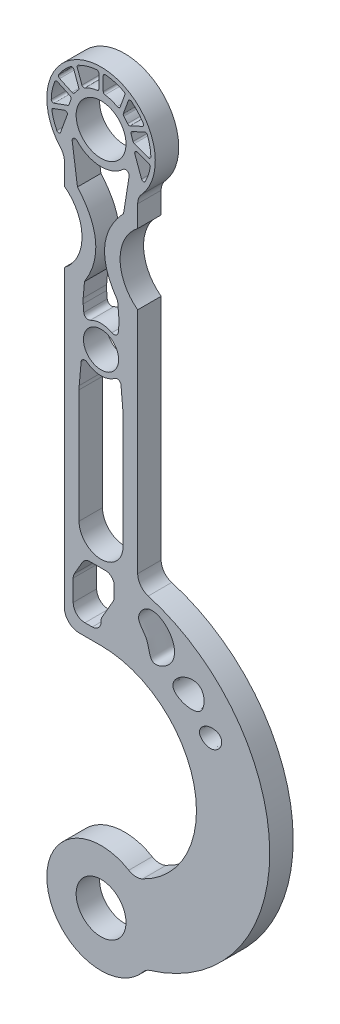
from build123d import *

# Parameters (mm, degrees)
BOSS_EXTRUDE1_OUTLINE_R   = 8.5
BOSS_EXTRUDE1_OUTLINE_R_2 = 6
BOSS_EXTRUDE1_DEPTH       = 8
FILLET1_R                 = 5


# Read off the part's stored shape, not the designer's step: Boss-Extrude1
with BuildPart() as part:
    # Boss-Extrude1 outline → Boss-Extrude1 (new body)
    with BuildSketch(Plane.XY):
        with BuildLine():
            ThreePointArc((11.444366088, -215.464647068), (-18.29086587, -232.773846738), (15.239317045, -240.488718511))
            ThreePointArc((15.239317045, -240.488718511), (57.52601951, -183.58870793), (12.5, -128.830749818))
            Line((12.5, -128.830749818), (12.5, -47))
            ThreePointArc((12.5, -47), (6.5, -35), (12.5, -23))
            Line((12.5, -23), (12.5, -13.638181697))
            ThreePointArc((12.5, -13.638181697), (0, 18.5), (-12.5, -13.638181697))
            Line((-12.5, -13.638181697), (-12.5, -23))
            ThreePointArc((-12.5, -23), (-6.5, -35), (-12.5, -47))
            Line((-12.5, -47), (-12.5, -152.456671403))
            Line((-12.5, -152.456671403), (0, -152.456671403))
            ThreePointArc((0, -152.456671403), (32.019441409, -179.184193262), (11.444366088, -215.464647068))
        make_face()
        with Locations((0, -230)):
            Circle(BOSS_EXTRUDE1_OUTLINE_R, mode=Mode.SUBTRACT)
        with BuildLine():
            Line((0, -145.26051898), (0, -145.456671403))
            ThreePointArc((0, -145.456671403), (-0.878679656, -147.577991747), (-3, -148.456671403))
            Line((-3, -148.456671403), (-5.5, -148.456671403))
            ThreePointArc((-5.5, -148.456671403), (-8.328427125, -147.285098528), (-9.5, -144.456671403))
            Line((-9.5, -144.456671403), (-9.5, -137.26051898))
            ThreePointArc((-9.5, -137.26051898), (-9.397777479, -136.484061845), (-9.098076211, -135.76051898))
            Line((-9.098076211, -135.76051898), (-6.366025404, -131.028468173))
            ThreePointArc((-6.366025404, -131.028468173), (-5.267949192, -129.930391962), (-3.767949192, -129.528468173))
            Line((-3.767949192, -129.528468173), (1.5, -129.528468173))
            ThreePointArc((1.5, -129.528468173), (3.621320344, -130.407147829), (4.5, -132.528468173))
            Line((4.5, -132.528468173), (4.5, -135.858595192))
            ThreePointArc((4.5, -135.858595192), (4.397777479, -136.635052327), (4.098076211, -137.358595192))
            Line((4.098076211, -137.358595192), (0.401923789, -143.76051898))
            ThreePointArc((0.401923789, -143.76051898), (0.102222521, -144.484061845), (0, -145.26051898))
        make_face(mode=Mode.SUBTRACT)
        with BuildLine():
            add(Edge.make_bspline(
                [(12.815143019, -137.878749683), (12.866993456, -139.570347571), (16.491087034, -142.280223185), (16.310410409, -150.377955966), (25.734531415, -146.267961615), (25.451879628, -136.604366129), (16.250652394, -131.320333816), (12.769637961, -136.394167023), (12.815143019, -137.878749683)],
                knots=[0, 0, 0, 0, 0.137048811, 0.2897108, 0.433708709, 0.660987574, 0.879723018, 1, 1, 1, 1], degree=3))
        make_face(mode=Mode.SUBTRACT)
        with BuildLine():
            add(Edge.make_bspline(
                [(24.511120075, -152.176773926), (24.850121969, -154.996634181), (32.927811052, -157.589174397), (35.554505954, -152.068234857), (34.488723033, -145.982053155), (26.960336222, -147.163037807), (24.367171844, -150.979394496), (24.511120075, -152.176773926)],
                knots=[0, 0, 0, 0, 0.33322372, 0.433356634, 0.598927888, 0.858505319, 1, 1, 1, 1], degree=3))
        make_face(mode=Mode.SUBTRACT)
        with BuildLine():
            add(Edge.make_bspline(
                [(33.562174624, -161.381398687), (33.690796307, -162.673135115), (36.87002002, -165.289122939), (41.07485268, -162.86784016), (41.421142388, -158.168250022), (36.061210717, -157.141905351), (33.435237138, -160.106576511), (33.562174624, -161.381398687)],
                knots=[0, 0, 0, 0, 0.203415558, 0.436316979, 0.557525748, 0.799248005, 1, 1, 1, 1], degree=3))
        make_face(mode=Mode.SUBTRACT)
        with BuildLine():
            Line((-7.442920471, -79.347578002), (-6.805813949, -72.065417124))
            ThreePointArc((-6.805813949, -72.065417124), (-6.034209722, -70.988761075), (-4.719159836, -71.147522301))
            ThreePointArc((-4.719159836, -71.147522301), (0, -72.75), (4.719159836, -71.147522301))
            ThreePointArc((4.719159836, -71.147522301), (6.034209722, -70.988761075), (6.805813949, -72.065417124))
            Line((6.805813949, -72.065417124), (7.442920471, -79.347578002))
            ThreePointArc((7.442920471, -79.347578002), (7.485723324, -80.000623333), (7.5, -80.654914144))
            Line((7.5, -80.654914144), (7.5, -119.456671403))
            ThreePointArc((7.5, -119.456671403), (0, -126.956671403), (-7.5, -119.456671403))
            Line((-7.5, -119.456671403), (-7.5, -80.654914144))
            ThreePointArc((-7.5, -80.654914144), (-7.485723324, -80.000623333), (-7.442920471, -79.347578002))
        make_face(mode=Mode.SUBTRACT)
        with Locations((0, -65)):
            Circle(BOSS_EXTRUDE1_OUTLINE_R_2, mode=Mode.SUBTRACT)
        with BuildLine():
            add(Edge.make_bspline(
                [(5.648127088, -47.738954624), (-4.174062702, -33.842492349), (7.673926753, -21)],
                knots=[0, 0, 0, 1, 1, 1], degree=2))
            Line((5.648127088, -47.738954624), (6.09481015, -52.844565385))
            ThreePointArc((6.09481015, -52.844565385), (6.132863169, -53.716122812), (6.09481015, -54.58768024))
            Line((6.09481015, -54.58768024), (5.884715734, -56.989070402))
            ThreePointArc((5.884715734, -56.989070402), (5.102294219, -58.178655062), (3.678463089, -58.178606498))
            ThreePointArc((3.678463089, -58.178606498), (0, -57.25), (-3.678463089, -58.178606498))
            ThreePointArc((-3.678463089, -58.178606498), (-5.102294219, -58.178655062), (-5.884715734, -56.989070402))
            Line((-5.884715734, -56.989070402), (-6.09481015, -54.58768024))
            ThreePointArc((-6.09481015, -54.58768024), (-6.132863169, -53.716122813), (-6.09481015, -52.844565385))
            Line((-6.09481015, -52.844565385), (-5.648127088, -47.738954624))
            add(Edge.make_bspline(
                [(-5.648127088, -47.738954624), (3.128574043, -33.737896343), (-8.048642471, -21)],
                knots=[0, 0, 0, 1, 1, 1], degree=2))
            Line((-8.048642471, -21), (-9.841693034, -8.241782316))
            ThreePointArc((-9.841693034, -8.241782316), (-9.277765095, -7.198046285), (-8.113806218, -7.42739178))
            ThreePointArc((-8.113806218, -7.42739178), (-0.397271684, -10.992823805), (7.556500402, -7.993703877))
            ThreePointArc((7.556500402, -7.993703877), (8.94060696, -7.804298326), (9.566071909, -9.053465659))
            Line((9.566071909, -9.053465659), (7.673926753, -21))
        make_face(mode=Mode.SUBTRACT)
        with BuildLine():
            ThreePointArc((-13.815819109, -7.73639942), (-14.428534406, -8.19553291), (-15.095169757, -7.818941744))
            ThreePointArc((-15.095169757, -7.818941744), (-16.142337475, -5.331504557), (-16.782656624, -2.709693088))
            ThreePointArc((-16.782656624, -2.709693088), (-16.695278148, -2.243744795), (-16.331020158, -1.940332656))
            Line((-16.331020158, -1.940332656), (-12.41062413, -0.513425195))
            ThreePointArc((-12.41062413, -0.513425195), (-11.676235283, -0.676235283), (-11.513425195, -1.41062413))
            Line((-11.513425195, -1.41062413), (-13.815819109, -7.73639942))
        make_face(mode=Mode.SUBTRACT)
        with BuildLine():
            ThreePointArc((-16.055325896, -0.243721492), (-16.703494721, -0.154196787), (-16.994514107, 0.431845204))
            ThreePointArc((-16.994514107, 0.431845204), (-16.65249891, 3.419690051), (-15.789347435, 6.300516452))
            ThreePointArc((-15.789347435, 6.300516452), (-15.397147551, 6.691822959), (-14.843365052, 6.675498873))
            Line((-14.843365052, 6.675498873), (-10.625129371, 4.708503271))
            ThreePointArc((-10.625129371, 4.708503271), (-10.278465342, 4.351932823), (-10.256089691, 3.855125251))
            Line((-10.256089691, 3.855125251), (-10.893744246, 1.918908676))
            ThreePointArc((-10.893744246, 1.918908676), (-11.056048513, 1.650608269), (-11.31920261, 1.48008641))
            Line((-11.31920261, 1.48008641), (-16.055325896, -0.243721492))
        make_face(mode=Mode.SUBTRACT)
        with BuildLine():
            ThreePointArc((-14.124081329, 7.995158243), (-14.499364019, 8.430566103), (-14.422099711, 9.000168884))
            ThreePointArc((-14.422099711, 9.000168884), (-12.600334129, 11.41190518), (-10.380271471, 13.462910688))
            ThreePointArc((-10.380271471, 13.462910688), (-9.757749538, 13.580817681), (-9.295063694, 13.147969642))
            Line((-9.295063694, 13.147969642), (-7.609901039, 8.518023301))
            ThreePointArc((-7.609901039, 8.518023301), (-7.584328716, 8.126875897), (-7.773038001, 7.783307795))
            ThreePointArc((-7.773038001, 7.783307795), (-8.440915114, 7.053435477), (-9.040513356, 6.266507661))
            ThreePointArc((-9.040513356, 6.266507661), (-9.433041522, 5.989569146), (-9.911651534, 6.03086997))
            Line((-9.911651534, 6.03086997), (-14.124081329, 7.995158243))
        make_face(mode=Mode.SUBTRACT)
        Circle(BOSS_EXTRUDE1_OUTLINE_R, mode=Mode.SUBTRACT)
        with BuildLine():
            ThreePointArc((-1.363247863, 10.915198361), (-3.503879738, 10.42702387), (-5.504917648, 9.523438543))
            ThreePointArc((-5.504917648, 9.523438543), (-6.094474876, 9.471628924), (-6.513015424, 9.890061441))
            Line((-6.513015424, 9.890061441), (-8.103729904, 14.260513555))
            ThreePointArc((-8.103729904, 14.260513555), (-8.097642283, 14.755448186), (-7.765709582, 15.122623935))
            ThreePointArc((-7.765709582, 15.122623935), (-4.726439667, 16.329751011), (-1.512269939, 16.932602861))
            ThreePointArc((-1.512269939, 16.932602861), (-0.977553684, 16.751899555), (-0.75, 16.235378037))
            Line((-0.75, 16.235378037), (-0.75, 11.609801893))
            ThreePointArc((-0.75, 11.609801893), (-0.925249347, 11.146512834), (-1.363247863, 10.915198361))
        make_face(mode=Mode.SUBTRACT)
        with BuildLine():
            ThreePointArc((1.512269939, 16.932602861), (4.726439667, 16.329751011), (7.765709582, 15.122623935))
            ThreePointArc((7.765709582, 15.122623935), (8.097642283, 14.755448186), (8.103729904, 14.260513555))
            Line((8.103729904, 14.260513555), (6.513015424, 9.890061441))
            ThreePointArc((6.513015424, 9.890061441), (6.094474876, 9.471628924), (5.504917648, 9.523438543))
            ThreePointArc((5.504917648, 9.523438543), (3.503879738, 10.42702387), (1.363247863, 10.915198361))
            ThreePointArc((1.363247863, 10.915198361), (0.925249347, 11.146512834), (0.75, 11.609801893))
            Line((0.75, 11.609801893), (0.75, 16.235378037))
            ThreePointArc((0.75, 16.235378037), (0.977553684, 16.751899555), (1.512269939, 16.932602861))
        make_face(mode=Mode.SUBTRACT)
        with BuildLine():
            Line((13.815819109, -7.73639942), (11.513425195, -1.41062413))
            ThreePointArc((11.513425195, -1.41062413), (11.676235283, -0.676235283), (12.41062413, -0.513425195))
            Line((12.41062413, -0.513425195), (16.331020158, -1.940332656))
            ThreePointArc((16.331020158, -1.940332656), (16.695278148, -2.243744795), (16.782656624, -2.709693088))
            ThreePointArc((16.782656624, -2.709693088), (16.142337475, -5.331504557), (15.095169757, -7.818941744))
            ThreePointArc((15.095169757, -7.818941744), (14.428534406, -8.19553291), (13.815819109, -7.73639942))
        make_face(mode=Mode.SUBTRACT)
        with BuildLine():
            Line((7.609901039, 8.518023301), (9.295063694, 13.147969642))
            ThreePointArc((9.295063694, 13.147969642), (9.757749538, 13.580817681), (10.380271471, 13.462910688))
            ThreePointArc((10.380271471, 13.462910688), (12.600334129, 11.41190518), (14.422099711, 9.000168884))
            ThreePointArc((14.422099711, 9.000168884), (14.499364019, 8.430566103), (14.124081329, 7.995158243))
            Line((14.124081329, 7.995158243), (9.911651534, 6.03086997))
            ThreePointArc((9.911651534, 6.03086997), (9.433041522, 5.989569146), (9.040513356, 6.266507661))
            ThreePointArc((9.040513356, 6.266507661), (8.440915114, 7.053435477), (7.773038001, 7.783307795))
            ThreePointArc((7.773038001, 7.783307795), (7.584328716, 8.126875897), (7.609901039, 8.518023301))
        make_face(mode=Mode.SUBTRACT)
        with BuildLine():
            ThreePointArc((11.31920261, 1.48008641), (11.056048513, 1.650608269), (10.893744246, 1.918908676))
            Line((10.893744246, 1.918908676), (10.256089691, 3.855125251))
            ThreePointArc((10.256089691, 3.855125251), (10.278465342, 4.351932823), (10.625129371, 4.708503271))
            Line((10.625129371, 4.708503271), (14.843365052, 6.675498873))
            ThreePointArc((14.843365052, 6.675498873), (15.397147551, 6.691822959), (15.789347435, 6.300516452))
            ThreePointArc((15.789347435, 6.300516452), (16.65249891, 3.419690051), (16.994514107, 0.431845204))
            ThreePointArc((16.994514107, 0.431845204), (16.703494721, -0.154196787), (16.055325896, -0.243721492))
            Line((16.055325896, -0.243721492), (11.31920261, 1.48008641))
        make_face(mode=Mode.SUBTRACT)
    extrude(amount=BOSS_EXTRUDE1_DEPTH)

    # Fillet1
    fillet1_edges = [part.edges().sort_by_distance(p)[0] for p in [
        (11.444366088, -215.464647068, 4),
        (-12.5, -152.456671403, 4),
        (-12.5, -13.638181697, 4),
        (12.5, -13.638181697, 4),
        (12.5, -128.830749818, 4),
        (15.239317045, -240.488718511, 4),
    ]]
    fillet(fillet1_edges, radius=FILLET1_R)


solid = part.part
